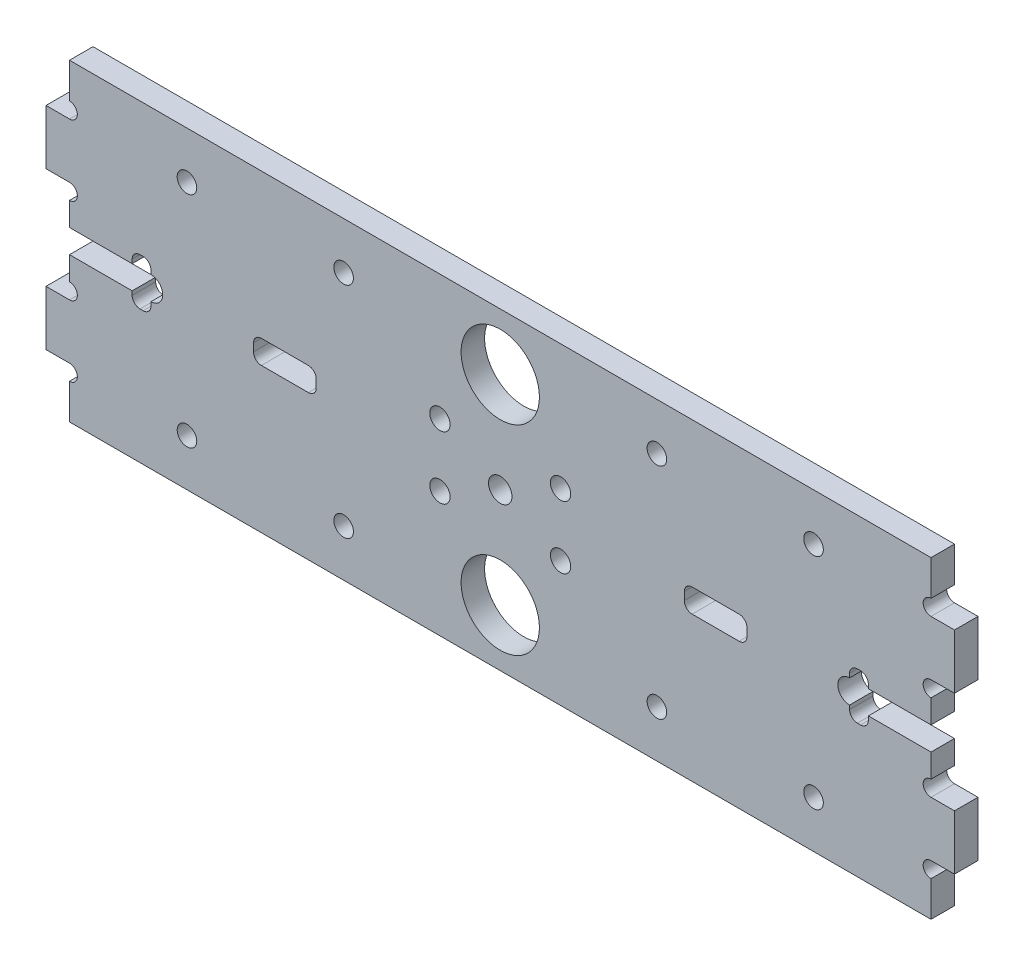
from build123d import *

# Parameters (mm, degrees)
SKETCH1_W           = 110
SKETCH1_H           = 40
BOSS_EXTRUDE1_DEPTH = 3
BOSS_EXTRUDE2_DEPTH = 3
SKETCH3_R           = 1.5
CUT_EXTRUDE1_DEPTH  = 3
CUT_EXTRUDE2_DEPTH  = 3
FILLET6_R           = 1
SKETCH5_W           = 8
SKETCH5_H           = 3
CUT_EXTRUDE3_DEPTH  = 10
FILLET7_R           = 1
SKETCH6_R           = 1.25
CUT_EXTRUDE4_DEPTH  = 62.424750712
SKETCH7_R           = 1.3
CUT_EXTRUDE5_DEPTH  = 10
SKETCH8_R           = 5
CUT_EXTRUDE6_DEPTH  = 10


with BuildPart() as part:
    # Sketch1 → Boss-Extrude1 (new body)
    with BuildSketch(Plane.XY):
        Rectangle(SKETCH1_W, SKETCH1_H)
    extrude(amount=BOSS_EXTRUDE1_DEPTH)

    # Sketch2 → Boss-Extrude2 (add)
    with BuildSketch(Plane.XY.offset(3)):
        Polygon((58, 10), (58, 13.5), (55, 13.5), (55, 6.5), (58, 6.5), align=None)
        Polygon((55, -10), (55, -6.5), (58, -6.5), (58, -13.5), (55, -13.5), align=None)
        Polygon((-55, 6.5), (-55, 13.5), (-58, 13.5), (-58, 10), (-58, 6.5), align=None)
        Polygon((-55, -13.5), (-55, -10), (-55, -6.5), (-58, -6.5), (-58, -13.5), align=None)
    extrude(amount=-BOSS_EXTRUDE2_DEPTH)

    # Sketch3 → Cut-Extrude1 (cut)
    with BuildSketch(Plane.XY.offset(3)):
        Circle(SKETCH3_R)
        with BuildLine():
            Line((-55, 15.5), (-55, 13.5))
            ThreePointArc((-55, 13.5), (-54, 14.5), (-55, 15.5))
        make_face()
        with BuildLine():
            ThreePointArc((-55, 4.5), (-54, 5.5), (-55, 6.5))
            Line((-55, 6.5), (-55, 4.5))
        make_face()
        with BuildLine():
            ThreePointArc((-55, -6.5), (-54, -5.5), (-55, -4.5))
            Line((-55, -4.5), (-55, -6.5))
        make_face()
        with BuildLine():
            ThreePointArc((-55, -15.5), (-54, -14.5), (-55, -13.5))
            Line((-55, -13.5), (-55, -15.5))
        make_face()
        with BuildLine():
            ThreePointArc((55, 15.5), (54, 14.5), (55, 13.5))
            Line((55, 13.5), (55, 15.5))
        make_face()
        with BuildLine():
            Line((55, -6.5), (55, -4.5))
            ThreePointArc((55, -4.5), (54, -5.5), (55, -6.5))
        make_face()
        with BuildLine():
            Line((55, 4.5), (55, 6.5))
            ThreePointArc((55, 6.5), (54, 5.5), (55, 4.5))
        make_face()
        with BuildLine():
            Line((55, -15.5), (55, -13.5))
            ThreePointArc((55, -13.5), (54, -14.5), (55, -15.5))
        make_face()
    extrude(amount=-CUT_EXTRUDE1_DEPTH, mode=Mode.SUBTRACT)

    # Sketch4 → Cut-Extrude2 (cut)
    with BuildSketch(Plane.XY.offset(3)):
        with BuildLine():
            Line((-47, 1.5), (-55, 1.5))
            Line((-55, 1.5), (-55, -1.5))
            Line((-55, -1.5), (-47, -1.5))
            Line((-47, -1.5), (-47, -3))
            Line((-47, -3), (-44.6, -3))
            Line((-44.6, -3), (-44.6, -1.5))
            ThreePointArc((-44.6, -1.5), (-43.1, 0), (-44.6, 1.5))
            Line((-44.6, 1.5), (-44.6, 3))
            Line((-44.6, 3), (-47, 3))
            Line((-47, 3), (-47, 1.5))
        make_face()
        with BuildLine():
            Line((47, 3), (44.6, 3))
            Line((44.6, 3), (44.6, 1.5))
            ThreePointArc((44.6, 1.5), (43.1, 0), (44.6, -1.5))
            Line((44.6, -1.5), (44.6, -3))
            Line((44.6, -3), (47, -3))
            Line((47, -3), (47, -1.5))
            Line((47, -1.5), (55, -1.5))
            Line((55, -1.5), (55, 1.5))
            Line((55, 1.5), (47, 1.5))
            Line((47, 1.5), (47, 3))
        make_face()
    extrude(amount=-CUT_EXTRUDE2_DEPTH, mode=Mode.SUBTRACT)

    # Fillet6
    fillet6_edges = [part.edges().sort_by_distance(p)[0] for p in [
        (-44.6, 3, 1.5),
        (-47, 3, 1.5),
        (-44.6, -3, 1.5),
        (-47, -3, 1.5),
        (47, 3, 1.5),
        (44.6, 3, 1.5),
        (47, -3, 1.5),
        (44.6, -3, 1.5),
    ]]
    fillet(fillet6_edges, radius=FILLET6_R)

    # Sketch5 → Cut-Extrude3 (cut)
    with BuildSketch(Plane.XY.offset(3)):
        with Locations((-27.5, 0)):
            Rectangle(SKETCH5_W, SKETCH5_H)
        with Locations((27.5, 0)):
            Rectangle(SKETCH5_W, SKETCH5_H)
    extrude(amount=-CUT_EXTRUDE3_DEPTH, mode=Mode.SUBTRACT)

    # Fillet7
    fillet7_edges = [part.edges().sort_by_distance(p)[0] for p in [
        (-31.5, -1.5, 1.5),
        (-31.5, 1.5, 1.5),
        (-23.5, 1.5, 1.5),
        (23.5, -1.5, 1.5),
        (23.5, 1.5, 1.5),
        (31.5, 1.5, 1.5),
        (31.5, -1.5, 1.5),
        (-23.5, -1.5, 1.5),
    ]]
    fillet(fillet7_edges, radius=FILLET7_R)

    # Sketch6 → Cut-Extrude4 (cut, through all)
    with BuildSketch(Plane.XY.offset(3)):
        with Locations((0, 14)):
            Circle(SKETCH6_R)
        with Locations((0, -14)):
            Circle(SKETCH6_R)
        with Locations((20, -14)):
            Circle(SKETCH6_R)
        with Locations((20, 14)):
            Circle(SKETCH6_R)
        with Locations((40, -14)):
            Circle(SKETCH6_R)
        with Locations((40, 14)):
            Circle(SKETCH6_R)
        with Locations((-20, -14)):
            Circle(SKETCH6_R)
        with Locations((-20, 14)):
            Circle(SKETCH6_R)
        with Locations((-40, -14)):
            Circle(SKETCH6_R)
        with Locations((-40, 14)):
            Circle(SKETCH6_R)
    extrude(amount=-CUT_EXTRUDE4_DEPTH, mode=Mode.SUBTRACT)

    # Sketch7 → Cut-Extrude5 (cut)
    with BuildSketch(Plane.XY.offset(3)):
        with Locations((-7.7, 4)):
            Circle(SKETCH7_R)
        with Locations((7.7, 4)):
            Circle(SKETCH7_R)
        with Locations((7.7, -4)):
            Circle(SKETCH7_R)
        with Locations((-7.7, -4)):
            Circle(SKETCH7_R)
    extrude(amount=-CUT_EXTRUDE5_DEPTH, mode=Mode.SUBTRACT)

    # Sketch8 → Cut-Extrude6 (cut)
    with BuildSketch(Plane.XY.offset(3)):
        with Locations((0, -12.75)):
            Circle(SKETCH8_R)
        with Locations((0, 12.75)):
            Circle(SKETCH8_R)
    extrude(amount=-CUT_EXTRUDE6_DEPTH, mode=Mode.SUBTRACT)


solid = part.part
